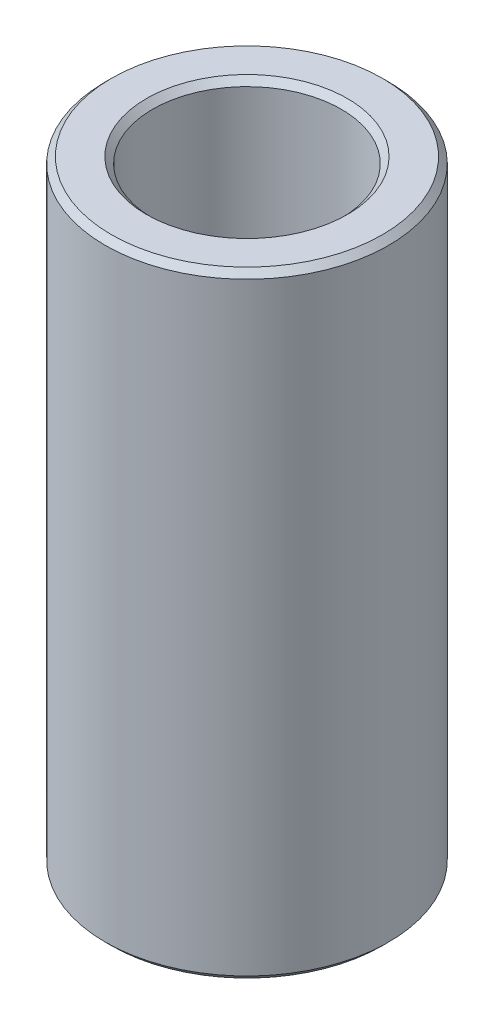
from build123d import *

# Parameters (mm, degrees)
SKETCH1_R           = 60
BOSS_EXTRUDE1_DEPTH = 260.795117135
SKETCH2_R           = 39.953089534
CUT_EXTRUDE1_DEPTH  = 275.251878975
CHAMFER1_SIZE       = 2.612361596


with BuildPart() as part:
    # Sketch1 → Boss-Extrude1 (new body)
    with BuildSketch(Plane(origin=(0, 0, 0), x_dir=(1, 0, 0), z_dir=(0, 1, 0))):
        Circle(SKETCH1_R)
    extrude(amount=BOSS_EXTRUDE1_DEPTH)

    # Sketch2 → Cut-Extrude1 (cut, through all)
    with BuildSketch(Plane(origin=(0, 0, 0), x_dir=(1, 0, 0), z_dir=(0, 1, 0))):
        Circle(SKETCH2_R)
    extrude(amount=CUT_EXTRUDE1_DEPTH, mode=Mode.SUBTRACT)

    # Chamfer1
    chamfer1_edges = [part.edges().sort_by_distance(p)[0] for p in [
        (-39.953089534, 260.795117135, 0),
        (-39.953089534, 0, 0),
        (-60, 0, 0),
        (-60, 260.795117135, 0),
    ]]
    chamfer(chamfer1_edges, length=CHAMFER1_SIZE)


solid = part.part
